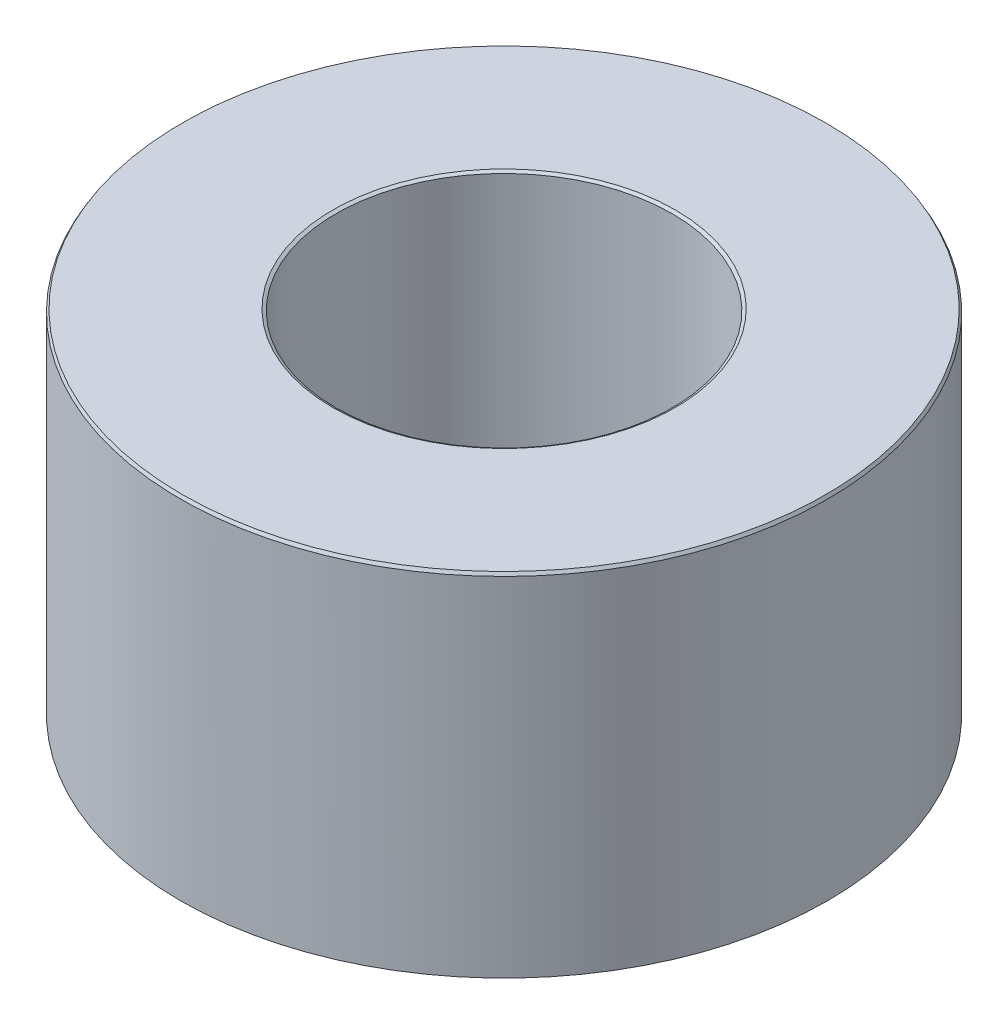
from build123d import *
from OCP.BRepFilletAPI import BRepFilletAPI_MakeChamfer

# Parameters (mm, degrees)
SKETCH1_R           = 22.5
BOSS_EXTRUDE1_DEPTH = 24.521899565
SKETCH2_R           = 11.693651116
CUT_EXTRUDE1_DEPTH  = 41.172422858
CHAMFER1_SIZE       = 0.21193301
CHAMFER1_SIZE2      = 0.12235958


with BuildPart() as part:
    # Sketch1 → Boss-Extrude1 (new body)
    with BuildSketch(Plane(origin=(0, 0, 0), x_dir=(1, 0, 0), z_dir=(0, 1, 0))):
        Circle(SKETCH1_R)
    extrude(amount=BOSS_EXTRUDE1_DEPTH)

    # Sketch2 → Cut-Extrude1 (cut, through all)
    with BuildSketch(Plane(origin=(0, 0, 0), x_dir=(1, 0, 0), z_dir=(0, 1, 0))):
        Circle(SKETCH2_R)
    extrude(amount=CUT_EXTRUDE1_DEPTH, mode=Mode.SUBTRACT)

    # Chamfer1: one chamfer whose edges measure the first distance from different faces: ONE call of the kernel's chamfer builder (chamfer() names one face for all edges)
    chamfer1_edges_1 = [part.edges().sort_by_distance(p)[0] for p in [
        (-11.693651116, 24.521899565, 0),
    ]]
    chamfer1_side_1 = [part.faces().sort_by_distance(p)[0] for p in [
        (-21.863603897, 24.521899565, 0),
    ]]
    chamfer1_edges_2 = [part.edges().sort_by_distance(p)[0] for p in [
        (-11.693651116, 0, 0),
    ]]
    chamfer1_side_2 = [part.faces().sort_by_distance(p)[0] for p in [
        (-11.693651116, 12.260949782, 0),
    ]]
    chamfer1_edges_3 = [part.edges().sort_by_distance(p)[0] for p in [
        (-22.5, 0, 0),
    ]]
    chamfer1_side_3 = [part.faces().sort_by_distance(p)[0] for p in [
        (-21.863603897, 0, 0),
    ]]
    chamfer1_edges_4 = [part.edges().sort_by_distance(p)[0] for p in [
        (-22.5, 24.521899565, 0),
    ]]
    chamfer1_side_4 = [part.faces().sort_by_distance(p)[0] for p in [
        (-22.5, 12.260949782, 0),
    ]]
    chamfer1 = BRepFilletAPI_MakeChamfer(part.part.solid().wrapped)
    for e in chamfer1_edges_1:
        chamfer1.Add(CHAMFER1_SIZE, CHAMFER1_SIZE2, e.wrapped, chamfer1_side_1[0].wrapped)  # the first distance lies on this face
    for e in chamfer1_edges_2:
        chamfer1.Add(CHAMFER1_SIZE, CHAMFER1_SIZE2, e.wrapped, chamfer1_side_2[0].wrapped)  # the first distance lies on this face
    for e in chamfer1_edges_3:
        chamfer1.Add(CHAMFER1_SIZE, CHAMFER1_SIZE2, e.wrapped, chamfer1_side_3[0].wrapped)  # the first distance lies on this face
    for e in chamfer1_edges_4:
        chamfer1.Add(CHAMFER1_SIZE, CHAMFER1_SIZE2, e.wrapped, chamfer1_side_4[0].wrapped)  # the first distance lies on this face
    add(Compound.cast(chamfer1.Shape()), mode=Mode.REPLACE)


solid = part.part
